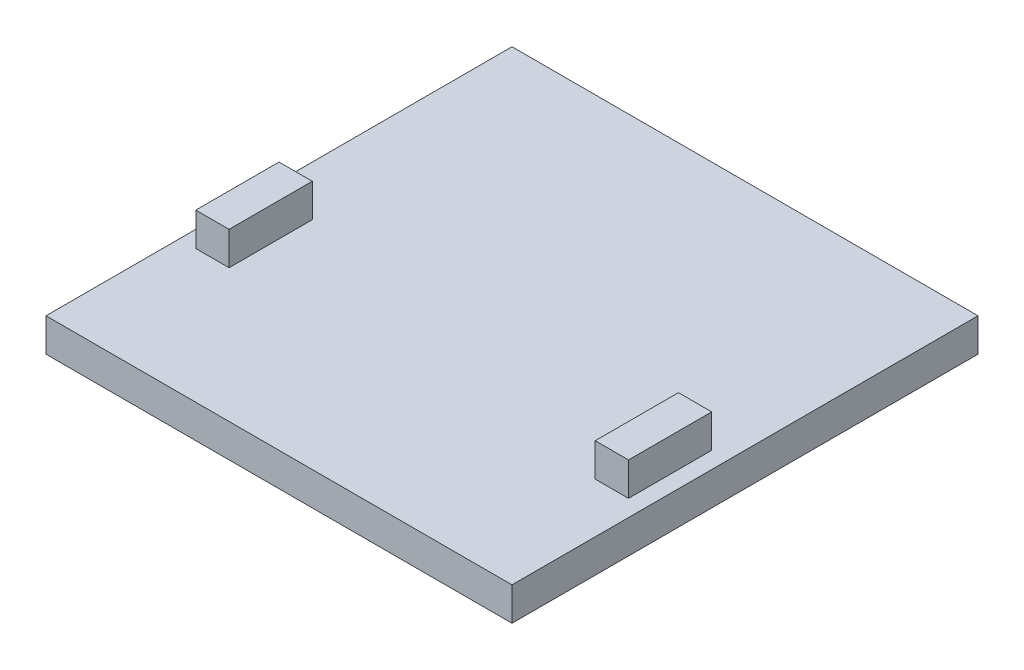
from build123d import *

# Parameters (mm, degrees)
SKETCH1_W           = 711.2
SKETCH1_H           = 711.2
BOSS_EXTRUDE1_DEPTH = 50.8
SKETCH2_W           = 50.8
SKETCH2_H           = 127
BOSS_EXTRUDE2_DEPTH = 50.8


with BuildPart() as part:
    # Sketch1 → Boss-Extrude1 (new body)
    with BuildSketch(Plane(origin=(0, 0, 0), x_dir=(1, 0, 0), z_dir=(0, 1, 0))):
        Rectangle(SKETCH1_W, SKETCH1_H)
    extrude(amount=BOSS_EXTRUDE1_DEPTH)

    # Sketch2 → Boss-Extrude2 (add)
    with BuildSketch(Plane(origin=(0, 50.8, 0), x_dir=(1, 0, 0), z_dir=(0, 1, 0))):
        with Locations((304.8, -88.9)):
            Rectangle(SKETCH2_W, SKETCH2_H)
        with Locations((-304.8, -88.9)):
            Rectangle(SKETCH2_W, SKETCH2_H)
    extrude(amount=BOSS_EXTRUDE2_DEPTH)


solid = part.part
